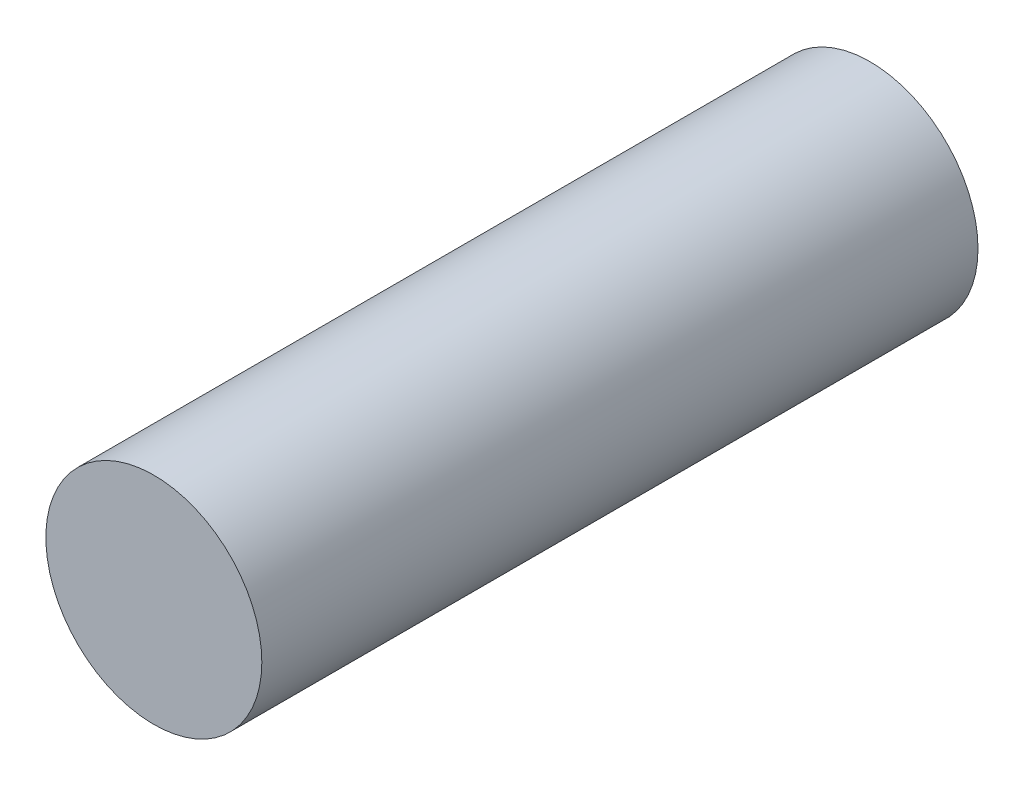
from build123d import *

# Parameters (mm, degrees)
SKETCH_1_R      = 16.15
EXTRUDE_1_DEPTH = 107.1


with BuildPart() as part:
    # ｽｹｯﾁ1 → ﾎﾞｽ - 押し出し1 (new body)
    with BuildSketch(Plane.XY):
        Circle(SKETCH_1_R)
    extrude(amount=EXTRUDE_1_DEPTH)


solid = part.part
